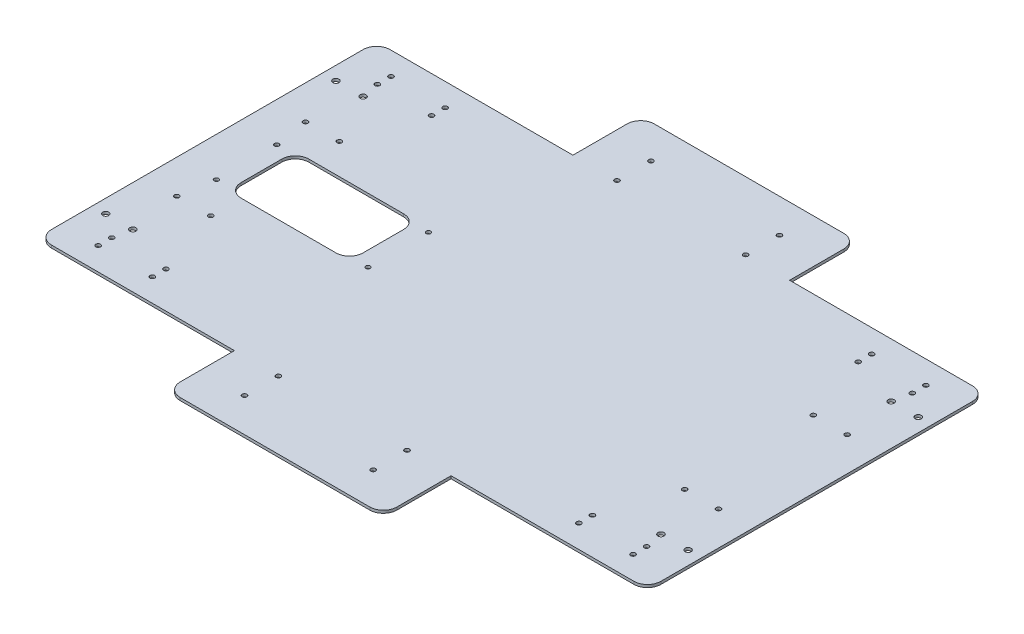
from build123d import *

# Parameters (mm, degrees)
SKETCH5_W            = 450
SKETCH5_H            = 350
BOSS_EXTRUDE1_DEPTH  = 2
FILLET1_R            = 10
CUT_EXTRUDE1_DEPTH   = 571.091220771
M4_CLEARANCE_HOLE1_D = 4.5
SKETCH13_R           = 1.75
CUT_EXTRUDE2_DEPTH   = 571.091220771
SKETCH14_R           = 1.75
CUT_EXTRUDE3_DEPTH   = 571.091220771
SKETCH15_W           = 145
SKETCH15_H           = 50
CUT_EXTRUDE4_DEPTH   = 571.091220771
FILLET2_R            = 10
SKETCH16_R           = 1.65
CUT_EXTRUDE5_DEPTH   = 571.091220771


with BuildPart() as part:
    # Sketch5 → Boss-Extrude1 (new body)
    with BuildSketch(Plane(origin=(0, 0, 0), x_dir=(1, 0, 0), z_dir=(0, 1, 0))):
        with Locations((225, 175)):
            Rectangle(SKETCH5_W, SKETCH5_H)
    extrude(amount=BOSS_EXTRUDE1_DEPTH)

    # Fillet1
    fillet1_edges = [part.edges().sort_by_distance(p)[0] for p in [
        (0, 1, -350),
        (450, 1, -350),
        (450, 1, 0),
        (0, 1, 0),
    ]]
    fillet(fillet1_edges, radius=FILLET1_R)

    # Sketch6 → Cut-Extrude1 (cut, through all)
    with BuildSketch(Plane(origin=(0, 2, 0), x_dir=(1, 0, 0), z_dir=(0, 1, 0))):
        with BuildLine():
            Line((130, 190), (130, 160))
            ThreePointArc((130, 160), (127.071067812, 152.928932188), (120, 150))
            Line((120, 150), (50, 150))
            ThreePointArc((50, 150), (42.928932188, 152.928932188), (40, 160))
            Line((40, 160), (40, 190))
            ThreePointArc((40, 190), (42.928932188, 197.071067812), (50, 200))
            Line((50, 200), (120, 200))
            ThreePointArc((120, 200), (127.071067812, 197.071067812), (130, 190))
        make_face()
    extrude(amount=-CUT_EXTRUDE1_DEPTH, mode=Mode.SUBTRACT)

    # M4 Clearance Hole1 (through all)
    with Locations(Plane(origin=(0, 2, 0), x_dir=(1, 0, 0), z_dir=(0, 1, 0))):
        with Locations((135, 10), (135, 30), (10, 90), (30, 90), (315, 10), (315, 30), (420, 90), (440, 90), (440, 260), (420, 260), (315, 340), (315, 320), (135, 340), (135, 320), (30, 260), (10, 260)):
            Hole(M4_CLEARANCE_HOLE1_D / 2)

    # Sketch13 → Cut-Extrude2 (cut, through all)
    with BuildSketch(Plane(origin=(0, 2, 0), x_dir=(1, 0, 0), z_dir=(0, 1, 0))):
        with Locations((272.499999169, 49.973842701)):
            Circle(SKETCH13_R)
        with Locations((272.499999169, 24.973842701)):
            Circle(SKETCH13_R)
        with Locations((177.499999169, 49.973842701)):
            Circle(SKETCH13_R)
        with Locations((177.499999169, 24.973842701)):
            Circle(SKETCH13_R)
        with Locations((25, 222.5)):
            Circle(SKETCH13_R)
        with Locations((50, 222.5)):
            Circle(SKETCH13_R)
        with Locations((50, 127.5)):
            Circle(SKETCH13_R)
        with Locations((25, 127.5)):
            Circle(SKETCH13_R)
        with Locations((177.499999169, 325.026157299)):
            Circle(SKETCH13_R)
        with Locations((272.499999169, 325.026157299)):
            Circle(SKETCH13_R)
        with Locations((272.499999169, 300.026157299)):
            Circle(SKETCH13_R)
        with Locations((177.499999169, 300.026157299)):
            Circle(SKETCH13_R)
        with Locations((425, 127.5)):
            Circle(SKETCH13_R)
        with Locations((400, 127.5)):
            Circle(SKETCH13_R)
        with Locations((400, 222.5)):
            Circle(SKETCH13_R)
        with Locations((425, 222.5)):
            Circle(SKETCH13_R)
    extrude(amount=-CUT_EXTRUDE2_DEPTH, mode=Mode.SUBTRACT)

    # Sketch14 → Cut-Extrude3 (cut, through all)
    with BuildSketch(Plane(origin=(0, 2, 0), x_dir=(1, 0, 0), z_dir=(0, 1, 0))):
        with Locations((27.5, 76.9004)):
            Circle(SKETCH14_R)
        with Locations((67.5, 76.9004)):
            Circle(SKETCH14_R)
        with Locations((67.5, 66.9004)):
            Circle(SKETCH14_R)
        with Locations((27.5, 66.9004)):
            Circle(SKETCH14_R)
        with Locations((67.5, 283.0996)):
            Circle(SKETCH14_R)
        with Locations((67.5, 273.0996)):
            Circle(SKETCH14_R)
        with Locations((27.5, 283.0996)):
            Circle(SKETCH14_R)
        with Locations((27.5, 273.0996)):
            Circle(SKETCH14_R)
        with Locations((382.5, 273.0996)):
            Circle(SKETCH14_R)
        with Locations((382.5, 283.0996)):
            Circle(SKETCH14_R)
        with Locations((422.5, 283.0996)):
            Circle(SKETCH14_R)
        with Locations((422.5, 273.0996)):
            Circle(SKETCH14_R)
        with Locations((422.5, 66.9004)):
            Circle(SKETCH14_R)
        with Locations((382.5, 66.9004)):
            Circle(SKETCH14_R)
        with Locations((382.5, 76.9004)):
            Circle(SKETCH14_R)
        with Locations((422.5, 76.9004)):
            Circle(SKETCH14_R)
    extrude(amount=-CUT_EXTRUDE3_DEPTH, mode=Mode.SUBTRACT)

    # Sketch15 → Cut-Extrude4 (cut, through all)
    with BuildSketch(Plane(origin=(0, 2, 0), x_dir=(1, 0, 0), z_dir=(0, 1, 0))):
        with Locations((72.5, 325)):
            Rectangle(SKETCH15_W, SKETCH15_H)
        with Locations((72.5, 25)):
            Rectangle(SKETCH15_W, SKETCH15_H)
        with Locations((377.5, 25)):
            Rectangle(SKETCH15_W, SKETCH15_H)
        with Locations((377.5, 325)):
            Rectangle(SKETCH15_W, SKETCH15_H)
    extrude(amount=-CUT_EXTRUDE4_DEPTH, mode=Mode.SUBTRACT)

    # Fillet2
    fillet2_edges = [part.edges().sort_by_distance(p)[0] for p in [
        (0, 1, -50),
        (145, 1, 0),
        (305, 1, 0),
        (450, 1, -50),
        (450, 1, -300),
        (305, 1, -350),
        (145, 1, -350),
        (0, 1, -300),
    ]]
    fillet(fillet2_edges, radius=FILLET2_R)

    # Sketch16 → Cut-Extrude5 (cut, through all)
    with BuildSketch(Plane(origin=(0, 2, 0), x_dir=(1, 0, 0), z_dir=(0, 1, 0))):
        with Locations((29, 197.3)):
            Circle(SKETCH16_R)
        with Locations((29, 152.7)):
            Circle(SKETCH16_R)
        with Locations((141, 152.7)):
            Circle(SKETCH16_R)
        with Locations((141, 197.3)):
            Circle(SKETCH16_R)
    extrude(amount=-CUT_EXTRUDE5_DEPTH, mode=Mode.SUBTRACT)


solid = part.part
